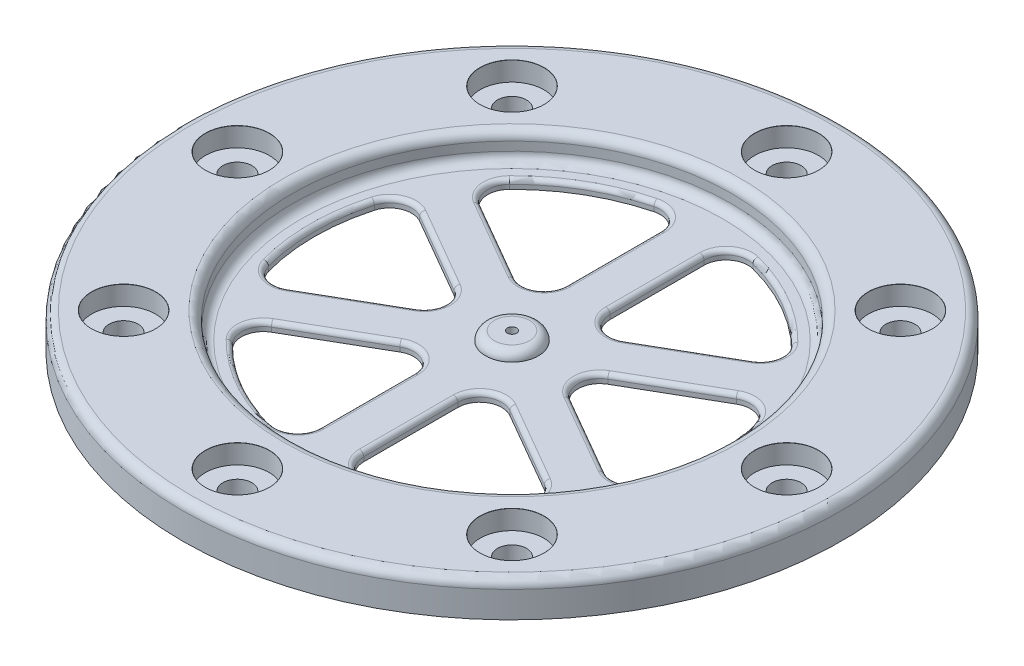
from build123d import *

# Parameters (mm, degrees)
SKETCH1_R                = 75
BOSS_EXTRUDE1_DEPTH      = 8
SKETCH2_R                = 50
CUT_EXTRUDE1_DEPTH       = 6
CUT_EXTRUDE2_DEPTH       = 107.235587258
FILLET2_R                = 1
CIRPATTERN1_COUNT        = 6
FILLET2_OF_CIRPATTERN1_R = 1
SKETCH4_R                = 6
SKETCH4_R_2              = 1.05
BOSS_EXTRUDE2_DEPTH      = 2
CUT_EXTRUDE3_DEPTH       = 107.141415103
CUT_EXTRUDE3_DEPTH_BACK  = 107.141415103
SKETCH5_R                = 1.05
FILLET1_R                = 2
FILLET3_R                = 2
CIRPATTERN2_COUNT        = 8


with BuildPart() as part:
    # Sketch1 → Boss-Extrude1 (new body)
    with BuildSketch(Plane(origin=(0, 0, 0), x_dir=(1, 0, 0), z_dir=(0, 1, 0))):
        with Locations(Location((0, 0, 0), (0, 0, 270))):
            Circle(SKETCH1_R)
    extrude(amount=BOSS_EXTRUDE1_DEPTH)

    # Sketch2 → Cut-Extrude1 (cut)
    with BuildSketch(Plane(origin=(0, 8, 0), x_dir=(1, 0, 0), z_dir=(0, 1, 0))):
        with Locations(Location((0, 0, 0), (0, 0, 270))):
            Circle(SKETCH2_R)
    extrude(amount=-CUT_EXTRUDE1_DEPTH, mode=Mode.SUBTRACT)

    # Sketch3 → Cut-Extrude2 (cut, through all)
    with BuildSketch(Plane(origin=(0, 2, 0), x_dir=(1, 0, 0), z_dir=(0, 1, 0))):
        with BuildLine():
            ThreePointArc((-5, 17.320508076), (-7.5, 12.990381057), (-12.5, 12.990381057))
            Line((-12.5, 12.990381057), (-31.041019662, 23.69504375))
            ThreePointArc((-31.041019662, 23.69504375), (-33.495216736, 27.349943877), (-32.10864712, 31.528317115))
            ThreePointArc((-32.10864712, 31.528317115), (-22.5, 38.97114317), (-11.25, 43.571062645))
            ThreePointArc((-11.25, 43.571062645), (-6.938137822, 42.682680537), (-5, 38.729833462))
            Line((-5, 38.729833462), (-5, 17.320508076))
        make_face()
    cut_extrude2 = extrude(amount=-CUT_EXTRUDE2_DEPTH, mode=Mode.SUBTRACT)

    # Fillet2
    fillet2_edges = [part.edges().sort_by_distance(p)[0] for p in [
        (-7.5, 2, -12.990381057),
        (-21.770509831, 2, -18.342712403),
        (-33.495216736, 2, -27.349943877),
        (-5, 2, -28.025170769),
        (-6.938137822, 2, -42.682680537),
        (-22.5, 2, -38.97114317),
    ]]
    fillet(fillet2_edges, radius=FILLET2_R)

    # CirPattern1: Cut-Extrude2 ×6 about axis
    cirpattern1_axis = Axis((0, 0, 0), (0, 1, 0))
    for i in range(1, CIRPATTERN1_COUNT):
        add(cut_extrude2.rotate(cirpattern1_axis, i * 360 / CIRPATTERN1_COUNT), mode=Mode.SUBTRACT)

    # Fillet2 of CirPattern1
    fillet2_of_cirpattern1_edges = [part.edges().sort_by_distance(p)[0] for p in [
        (-15, 2, 0),
        (-26.770509831, 2, 9.682458366),
        (-40.433354558, 2, 15.33273666),
        (-26.770509831, 2, -9.682458366),
        (-40.433354558, 2, -15.33273666),
        (-45, 2, 0),
        (-7.5, 2, 12.990381057),
        (-5, 2, 28.025170769),
        (-6.938137822, 2, 42.682680537),
        (-21.770509831, 2, 18.342712403),
        (-33.495216736, 2, 27.349943877),
        (-22.5, 2, 38.97114317),
        (7.5, 2, 12.990381057),
        (21.770509831, 2, 18.342712403),
        (33.495216736, 2, 27.349943877),
        (5, 2, 28.025170769),
        (6.938137822, 2, 42.682680537),
        (22.5, 2, 38.97114317),
        (15, 2, 0),
        (26.770509831, 2, -9.682458366),
        (40.433354558, 2, -15.33273666),
        (26.770509831, 2, 9.682458366),
        (40.433354558, 2, 15.33273666),
        (45, 2, 0),
        (7.5, 2, -12.990381057),
        (5, 2, -28.025170769),
        (6.938137822, 2, -42.682680537),
        (21.770509831, 2, -18.342712403),
        (33.495216736, 2, -27.349943877),
        (22.5, 2, -38.97114317),
    ]]
    fillet(fillet2_of_cirpattern1_edges, radius=FILLET2_OF_CIRPATTERN1_R)

    # Sketch4 → Boss-Extrude2 (add)
    with BuildSketch(Plane(origin=(0, 2, 0), x_dir=(1, 0, 0), z_dir=(0, 1, 0))):
        with Locations(Location((0, 0, 0), (0, 0, 270))):
            Circle(SKETCH4_R)
        with Locations(Location((0, 0, 0), (0, 0, 270))):
            Circle(SKETCH4_R_2, mode=Mode.SUBTRACT)
    extrude(amount=BOSS_EXTRUDE2_DEPTH)

    # Sketch5 → Cut-Extrude3 (cut, two sides: drawn at the far end of the back side and taken through both)
    with BuildSketch(Plane(origin=(0, 4, 0), x_dir=(1, 0, 0), z_dir=(0, 1, 0)).offset(-CUT_EXTRUDE3_DEPTH_BACK)):
        with Locations(Location((0, 0, 0), (0, 0, 270))):
            Circle(SKETCH5_R)
    extrude(amount=CUT_EXTRUDE3_DEPTH + CUT_EXTRUDE3_DEPTH_BACK, mode=Mode.SUBTRACT)

    # Fillet1
    fillet1_edges = [part.edges().sort_by_distance(p)[0] for p in [
        (0, 4, -6),
        (0, 8, -75),
        (0, 8, -50),
    ]]
    fillet(fillet1_edges, radius=FILLET1_R - 0.0001)  # a hair under: the kernel refuses the full size

    # Fillet3
    fillet3_edges = [part.edges().sort_by_distance(p)[0] for p in [
        (0, 2, -50),
    ]]
    fillet(fillet3_edges, radius=FILLET3_R)

    # Sketch20 → CBORE for M6 Hex Head Bolt2 (revolve, cut)
    with BuildSketch(Plane(origin=(0, 8, -62.5), x_dir=(0, 0, 1), z_dir=(1, 0, 0))):
        Polygon((0, 0), (0, 8), (3.3, 8), (3.3, 4.38), (7.275, 4.38), (7.275, 0.025), (7.3, 0), align=None)
    cbore_for_m6_hex_head_bolt2 = revolve(axis=Axis((0, 14.35, -62.5), (0, -1, 0)), mode=Mode.SUBTRACT)

    # CirPattern2: CBORE for M6 Hex Head Bolt2 ×8 about axis
    cirpattern2_axis = Axis((0, 0, 0), (0, 1, 0))
    for i in range(1, CIRPATTERN2_COUNT):
        add(cbore_for_m6_hex_head_bolt2.rotate(cirpattern2_axis, i * 360 / CIRPATTERN2_COUNT), mode=Mode.SUBTRACT)


solid = part.part
